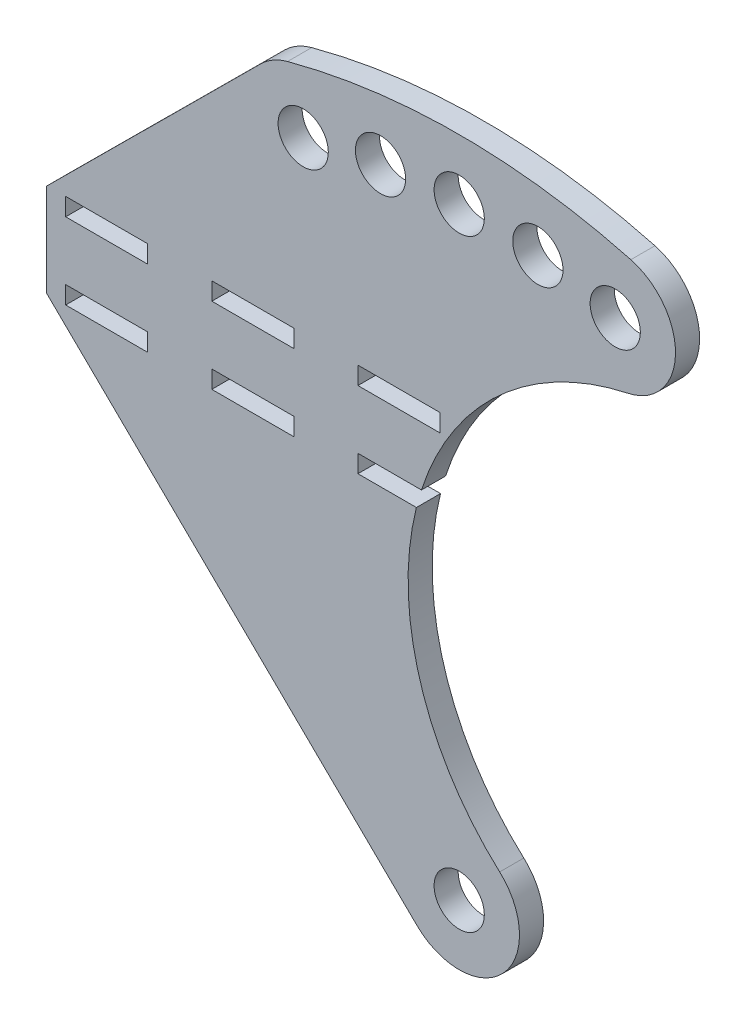
from build123d import *

# Parameters (mm, degrees)
SKETCH_1_R             = 6.25
SM_BASE_FLANGE_1_DEPTH = 6
OTHER_START            = 4.8
OTHER_1_OUTLINE_W      = 4.4
OTHER_1_OUTLINE_H      = 6
OTHER_1_DEPTH          = 20.4
OTHER_START_2          = 41.159902189
OTHER_1_2_OUTLINE_W    = 4.4
OTHER_1_2_OUTLINE_H    = 6
OTHER_1_2_DEPTH        = 20.4
OTHER_START_3          = 77.519804378
OTHER_1_3_OUTLINE_W    = 4.4
OTHER_1_3_OUTLINE_H    = 6
OTHER_1_3_DEPTH        = 20.4


# Read off the part's stored shape, not the designer's step: Выступы и прорези-Прорезь1
# Sheet-metal steps are written as plain solids
with BuildPart() as part:
    # Sketch 1 → Базовая кромка1 (new body)
    with BuildSketch(Plane.XY):
        with BuildLine():
            Line((0, 0), (0, -23))
            Line((0, -23), (92.230562732, -113.222677357))
            ThreePointArc((92.230562732, -113.222677357), (113.643192103, -112.780058395), (112.786839702, -91.379982025))
            ThreePointArc((112.786839702, -91.379982025), (92.360596545, -22.078545096), (144.700960487, 27.725138224))
            ThreePointArc((144.700960487, 27.725138224), (156.538037696, 42.016473572), (145.424946819, 56.877761338))
            ThreePointArc((145.424946819, 56.877761338), (102.719804378, 62.5), (60.014661936, 56.877761338))
            ThreePointArc((60.014661936, 56.877761338), (56.414969483, 55.389643277), (53.319804477, 53.024852653))
            Line((53.319804477, 53.024852653), (0, 0))
        make_face()
        with Locations((102.719804378, -102.5)):
            Circle(SKETCH_1_R, mode=Mode.SUBTRACT)
        with Locations((141.542661143, 42.388873943)):
            Circle(SKETCH_1_R, mode=Mode.SUBTRACT)
        with Locations((122.298733211, 46.216729206)):
            Circle(SKETCH_1_R, mode=Mode.SUBTRACT)
        with Locations((102.719804378, 47.5)):
            Circle(SKETCH_1_R, mode=Mode.SUBTRACT)
        with Locations((83.140875544, 46.216729206)):
            Circle(SKETCH_1_R, mode=Mode.SUBTRACT)
        with Locations((63.896947612, 42.388873943)):
            Circle(SKETCH_1_R, mode=Mode.SUBTRACT)
    extrude(amount=SM_BASE_FLANGE_1_DEPTH)

    # Other 1 outline → Other 1 (cut)
    with BuildSketch(Plane.YZ.offset(OTHER_START)):
        with Locations((-2, 3)):
            Rectangle(OTHER_1_OUTLINE_W, OTHER_1_OUTLINE_H)
    other_1 = extrude(amount=OTHER_1_DEPTH, mode=Mode.SUBTRACT)

    # Other 1 2 outline → Other 1 2 (cut)
    with BuildSketch(Plane.YZ.offset(OTHER_START_2)):
        with Locations((-2, 3)):
            Rectangle(OTHER_1_2_OUTLINE_W, OTHER_1_2_OUTLINE_H)
    other_1_2 = extrude(amount=OTHER_1_2_DEPTH, mode=Mode.SUBTRACT)

    # Other 1 3 outline → Other 1 3 (cut)
    with BuildSketch(Plane.YZ.offset(OTHER_START_3)):
        with Locations((-2, 3)):
            Rectangle(OTHER_1_3_OUTLINE_W, OTHER_1_3_OUTLINE_H)
    other_1_3 = extrude(amount=OTHER_1_3_DEPTH, mode=Mode.SUBTRACT)

    # Зеркальное отражение1: Other 1, Other 1 2, Other 1 3 across plane
    add(other_1.mirror(Plane.ZX.offset(-11.5)), mode=Mode.SUBTRACT)
    add(other_1_2.mirror(Plane.ZX.offset(-11.5)), mode=Mode.SUBTRACT)
    add(other_1_3.mirror(Plane.ZX.offset(-11.5)), mode=Mode.SUBTRACT)


solid = part.part
